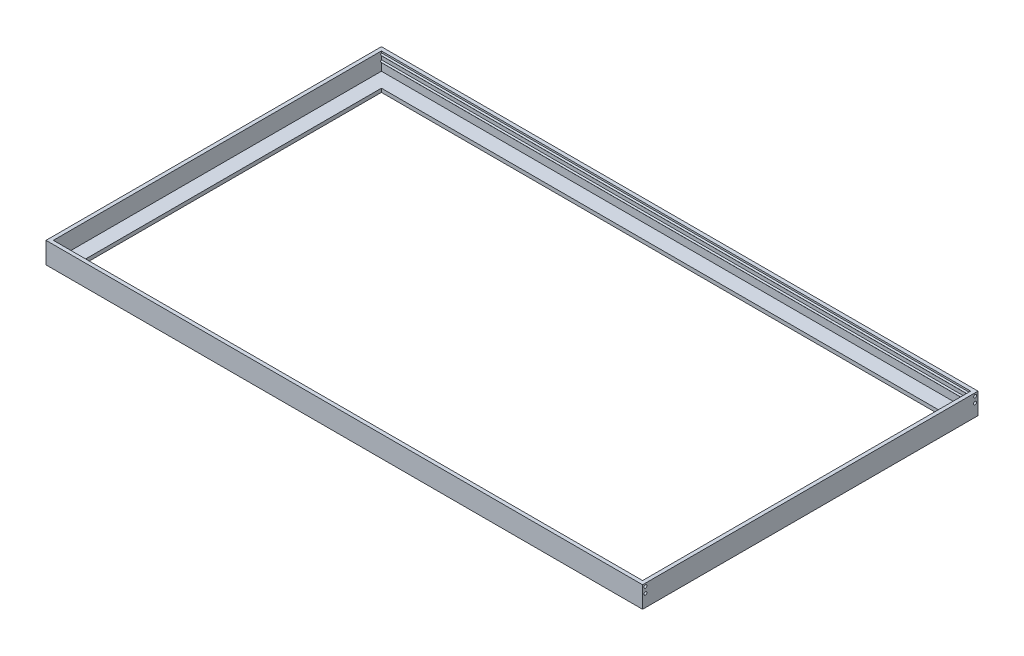
from build123d import *

# Parameters (mm, degrees)
SKETCH2_W           = 1626.4
SKETCH2_H           = 914.4
BOSS_EXTRUDE1_DEPTH = 100
SHELL1_T            = -10
SKETCH3_W           = 1526.4
SKETCH3_H           = 814.4
CUT_EXTRUDE1_DEPTH  = 1868.994732327
SKETCH5_R           = 4
CUT_EXTRUDE2_DEPTH  = 1869.503229861
SKETCH6_R           = 4
CUT_EXTRUDE3_DEPTH  = 1869.503229861
SKETCH7_R           = 4
CUT_EXTRUDE4_DEPTH  = 1869.503229861
SKETCH8_W           = 914.4
SKETCH8_H           = 42
CUT_EXTRUDE5_DEPTH  = 1869.503229861
SKETCH9_R           = 4
CUT_EXTRUDE8_DEPTH  = 1867.72663237


with BuildPart() as part:
    # Sketch2 → Boss-Extrude1 (new body)
    with BuildSketch(Plane(origin=(0, 0, 0), x_dir=(1, 0, 0), z_dir=(0, 1, 0))):
        with Locations((813.2, 457.2)):
            Rectangle(SKETCH2_W, SKETCH2_H)
    extrude(amount=BOSS_EXTRUDE1_DEPTH)

    # Shell1
    shell1_openings = [part.faces().sort_by_distance(p)[0] for p in [
        (813.2, 100, -457.2),
    ]]
    offset(amount=SHELL1_T, openings=shell1_openings, kind=Kind.INTERSECTION)

    # Sketch3 → Cut-Extrude1 (cut, through all)
    with BuildSketch(Plane(origin=(0, 10, 0), x_dir=(1, 0, 0), z_dir=(0, 1, 0))):
        with Locations((813.2, 457.2)):
            Rectangle(SKETCH3_W, SKETCH3_H)
    extrude(amount=-CUT_EXTRUDE1_DEPTH, mode=Mode.SUBTRACT)

    # Sketch5 → Cut-Extrude2 (cut, through all)
    with BuildSketch(Plane(origin=(1626.4, 0, 0), x_dir=(0, 0, -1), z_dir=(1, 0, 0))):
        with Locations((7.85, 50)):
            Circle(SKETCH5_R)
    extrude(amount=-CUT_EXTRUDE2_DEPTH, mode=Mode.SUBTRACT)

    # Sketch6 → Cut-Extrude3 (cut, through all)
    with BuildSketch(Plane(origin=(1626.4, 0, 0), x_dir=(0, 0, -1), z_dir=(1, 0, 0))):
        with Locations((7.85, 66.28)):
            Circle(SKETCH6_R)
    extrude(amount=-CUT_EXTRUDE3_DEPTH, mode=Mode.SUBTRACT)

    # Sketch7 → Cut-Extrude4 (cut, through all)
    with BuildSketch(Plane(origin=(1626.4, 0, 0), x_dir=(0, 0, -1), z_dir=(1, 0, 0))):
        with Locations((7.85, 33.72)):
            Circle(SKETCH7_R)
    extrude(amount=-CUT_EXTRUDE4_DEPTH, mode=Mode.SUBTRACT)

    # Sketch8 → Cut-Extrude5 (cut, through all)
    with BuildSketch(Plane(origin=(1626.4, 0, 0), x_dir=(0, 0, -1), z_dir=(1, 0, 0))):
        with Locations((457.2, 79)):
            Rectangle(SKETCH8_W, SKETCH8_H)
    extrude(amount=-CUT_EXTRUDE5_DEPTH, mode=Mode.SUBTRACT)

    # Sketch9 → Cut-Extrude8 (cut, through all)
    with BuildSketch(Plane(origin=(1626.4, 0, 0), x_dir=(0, 0, -1), z_dir=(1, 0, 0))):
        with Locations((906.5, 50)):
            Circle(SKETCH9_R)
        with Locations((906.5, 33.7)):
            Circle(SKETCH9_R)
    extrude(amount=-CUT_EXTRUDE8_DEPTH, mode=Mode.SUBTRACT)


solid = part.part
